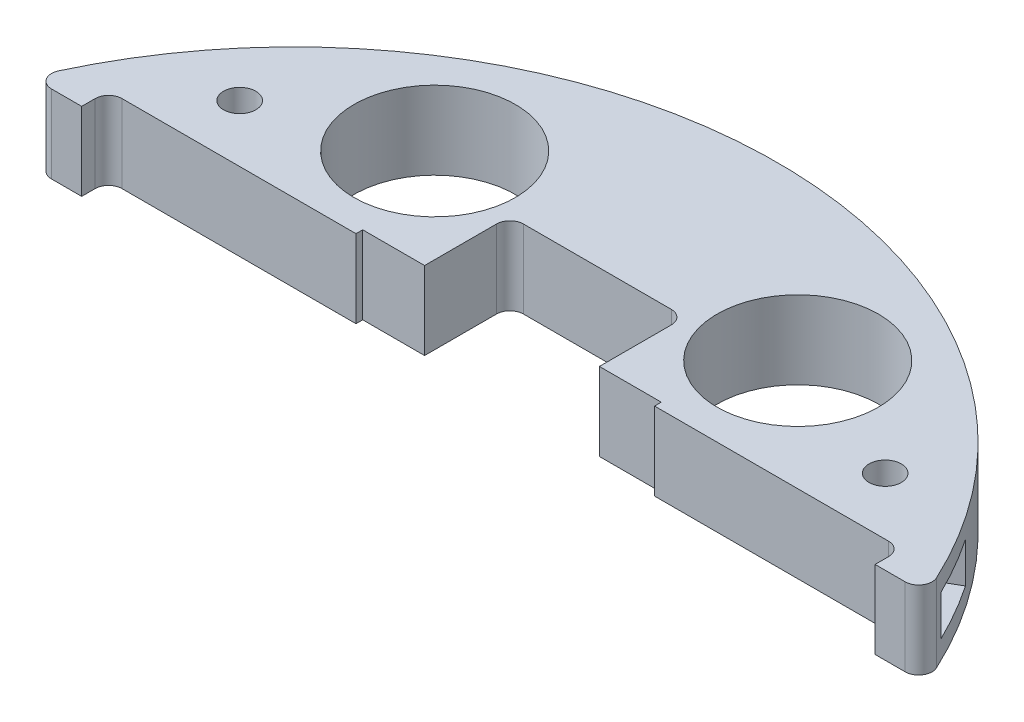
from build123d import *

# Parameters (mm, degrees)
BOSS_EXTRUDE1_DEPTH  = 5.8
SOLENOID_PLACEMENT_W = 38
SOLENOID_PLACEMENT_H = 64
CUT_EXTRUDE1_DEPTH   = 103.481998419
CUT_EXTRUDE4_DEPTH   = 103.481998419
SKETCH5_R            = 12
CUT_EXTRUDE5_DEPTH   = 103.481998419
SKETCH6_R            = 2.4
CUT_EXTRUDE6_DEPTH   = 103.481998419
CUT_EXTRUDE3_DEPTH   = 103.481998419
FILLET1_R            = 2
CUT_EXTRUDE7_DEPTH   = 3
SKETCH9_W            = 44.4
SKETCH9_H            = 65
CUT_EXTRUDE8_DEPTH   = 99.011383255


with BuildPart() as part:
    # Sketch1 → Boss-Extrude1 (new, symmetric)
    with BuildSketch(Plane(origin=(0, 0, 0), x_dir=(1, 0, 0), z_dir=(0, 1, 0))):
        with BuildLine():
            ThreePointArc((36.224522061, -62.223661106), (0, 72), (-36.224522061, -62.223661106))
            ThreePointArc((-36.224522061, -62.223661106), (-32.797800029, -62.818856853), (-29.811944095, -61.035223988))
            ThreePointArc((-29.811944095, -61.035223988), (0, -46.75), (29.811944095, -61.035223988))
            ThreePointArc((29.811944095, -61.035223988), (32.797800029, -62.818856853), (36.224522061, -62.223661106))
        make_face()
    extrude(amount=BOSS_EXTRUDE1_DEPTH, both=True)

    # solenoid placement → Cut-Extrude1 (cut, through all)
    with BuildSketch(Plane(origin=(0, 5.8, 0), x_dir=(1, 0, 0), z_dir=(0, 1, 0))):
        with Locations((0, -4)):
            Rectangle(SOLENOID_PLACEMENT_W, SOLENOID_PLACEMENT_H)
    extrude(amount=-CUT_EXTRUDE1_DEPTH, mode=Mode.SUBTRACT)

    # Sketch4 → Cut-Extrude4 (cut, through all)
    with BuildSketch(Plane(origin=(0, 5.8, 0), x_dir=(1, 0, 0), z_dir=(0, 1, 0))):
        with BuildLine():
            Line((-13, 28), (13, 28))
            Line((13, 28), (13, 43.2))
            ThreePointArc((13, 43.2), (12.414213562, 44.614213562), (11, 45.2))
            Line((11, 45.2), (-11, 45.2))
            ThreePointArc((-11, 45.2), (-12.414213562, 44.614213562), (-13, 43.2))
            Line((-13, 43.2), (-13, 28))
        make_face()
    extrude(amount=-CUT_EXTRUDE4_DEPTH, mode=Mode.SUBTRACT)

    # Sketch5 → Cut-Extrude5 (cut, through all)
    with BuildSketch(Plane(origin=(0, 5.8, 0), x_dir=(1, 0, 0), z_dir=(0, 1, 0))):
        with Locations((27, 48)):
            Circle(SKETCH5_R)
        with Locations((-27, 48)):
            Circle(SKETCH5_R)
    extrude(amount=-CUT_EXTRUDE5_DEPTH, mode=Mode.SUBTRACT)

    # Sketch6 → Cut-Extrude6 (cut, through all)
    with BuildSketch(Plane(origin=(0, 5.8, 0), x_dir=(1, 0, 0), z_dir=(0, 1, 0))):
        with Locations((48, 40)):
            Circle(SKETCH6_R)
        with Locations((-48, 40)):
            Circle(SKETCH6_R)
    extrude(amount=-CUT_EXTRUDE6_DEPTH, mode=Mode.SUBTRACT)

    # Sketch3 → Cut-Extrude3 (cut, through all)
    with BuildSketch(Plane(origin=(0, 5.8, 0), x_dir=(1, 0, 0), z_dir=(0, 1, 0))):
        Polygon((-19, 28), (19, 28), (19, 31.5), (59, 31.5), (59, 27.5), (72, 27.5), (72, -31.5), (72, -101.646422462), (-72, -101.646422462), (-72, -31.5), (-72, 27.5), (-59, 27.5), (-59, 31.5), (-19, 31.5), align=None)
    extrude(amount=-CUT_EXTRUDE3_DEPTH, mode=Mode.SUBTRACT)

    # Fillet1
    fillet1_edges = [part.edges().sort_by_distance(p)[0] for p in [
        (-66.541340534, 0, -27.5),
        (-59, 0, -31.5),
        (59, 0, -31.5),
        (66.541340534, 0, -27.5),
    ]]
    fillet(fillet1_edges, radius=FILLET1_R)

    # Sketch8 → Cut-Extrude7 (cut, symmetric)
    with BuildSketch(Plane(origin=(0, 0, 0), x_dir=(1, 0, 0), z_dir=(0, 1, 0))):
        with BuildLine():
            Line((5, 71.826179071), (5, 68.926179071))
            Line((5, 68.926179071), (-5, 68.926179071))
            Line((-5, 68.926179071), (-5, 71.826179071))
            ThreePointArc((-5, 71.826179071), (0, 72), (5, 71.826179071))
        make_face()
        with BuildLine():
            Line((64.703295733, 31.582962517), (62.191822062, 30.132962517))
            Line((62.191822062, 30.132962517), (57.191822062, 38.793216555))
            Line((57.191822062, 38.793216555), (59.703295733, 40.243216555))
            ThreePointArc((59.703295733, 40.243216555), (62.353829072, 36), (64.703295733, 31.582962517))
        make_face()
        with BuildLine():
            Line((-59.703295733, 40.243216555), (-57.191822062, 38.793216555))
            Line((-57.191822062, 38.793216555), (-62.191822062, 30.132962517))
            Line((-62.191822062, 30.132962517), (-64.703295733, 31.582962517))
            ThreePointArc((-64.703295733, 31.582962517), (-62.353829072, 36), (-59.703295733, 40.243216555))
        make_face()
    extrude(amount=CUT_EXTRUDE7_DEPTH, both=True, mode=Mode.SUBTRACT)

    # Sketch9 → Cut-Extrude8 (cut, through all)
    with BuildSketch(Plane(origin=(0, 5.8, 0), x_dir=(1, 0, 0), z_dir=(0, 1, 0))):
        Rectangle(SKETCH9_W, SKETCH9_H)
    extrude(amount=-CUT_EXTRUDE8_DEPTH, mode=Mode.SUBTRACT)


solid = part.part
